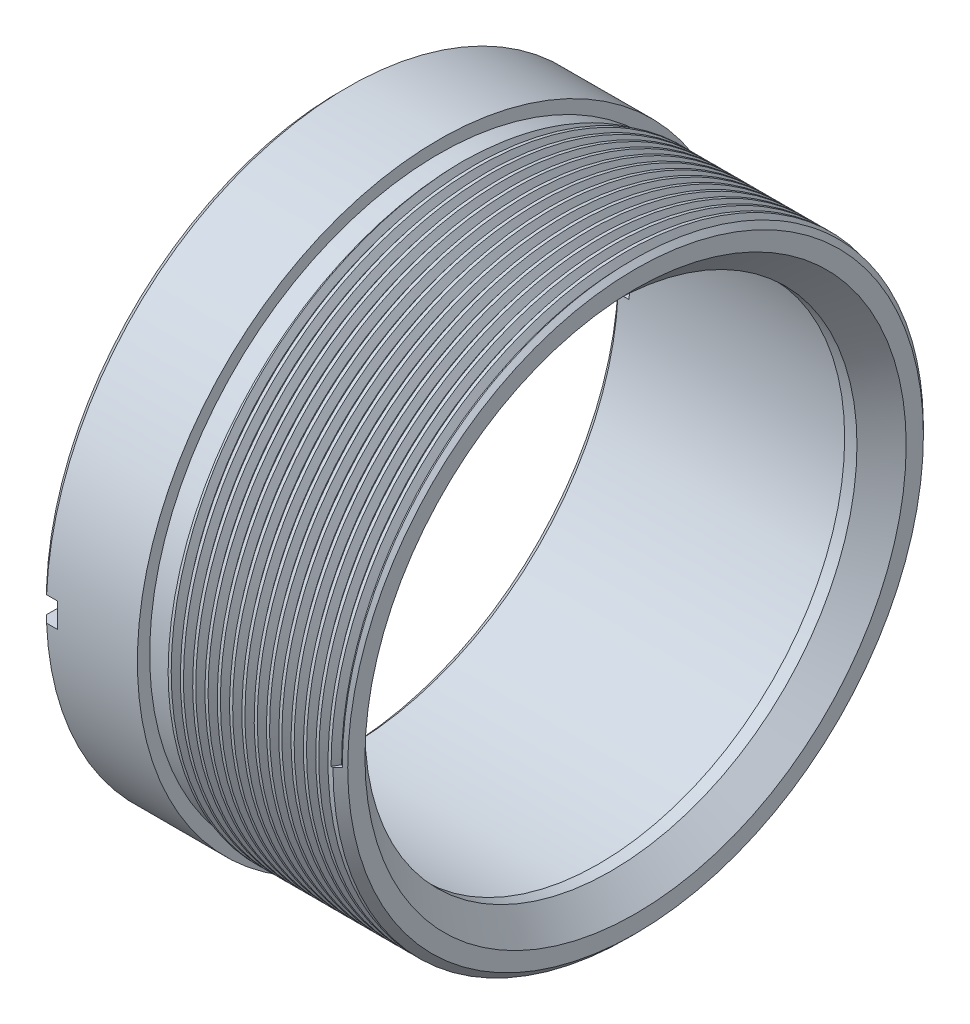
from build123d import *

# Parameters (mm, degrees)
SKETCH8_W          = 24.5
SKETCH8_H          = 1
CUT_EXTRUDE1_DEPTH = 0.75
THREAD3_PITCH      = 0.5


with BuildPart() as part:
    # Sketch1 → Revolve1 (revolve)
    with BuildSketch(Plane.XY, mode=Mode.PRIVATE) as revolve1_sk:
        Polygon((0, -11.3), (0, -11.95), (0.3, -12.25), (4, -12.25), (4, -11.75), (5, -11.75), (5, -12), (11.7, -12), (12, -11.7), (12, -11), (11, -10), (10.5, -10), (10.5, -11), (0.3, -11), align=None)
    revolve(revolve1_sk.sketch.rotate(Axis((35.470277062, 0, 0), (-1, 0, 0)), 270), axis=Axis((35.470277062, 0, 0), (-1, 0, 0)))

    # Sketch8 → Cut-Extrude1 (cut)
    with BuildSketch(Plane.ZY):
        Rectangle(SKETCH8_W, SKETCH8_H)
    extrude(amount=-CUT_EXTRUDE1_DEPTH, mode=Mode.SUBTRACT)

    # Thread3: the profile of Thread Profile3 profile screwed along a right-hand helix of 14 turns, 6 arcs to a turn; built about Z, then put on its axis
    thread3_z = Axis((0, 0, 0), (0, 0, 1))
    thread3_corners = [(12.0003, 0, 0.375173207), (11.72936706, 0, 0.218750001), (11.72936706, 0, 0.156250001), (12.0003, 0, -0.000173205)]
    with BuildLine(mode=Mode.PRIVATE) as thread3_profile:
        Line(thread3_corners[0], thread3_corners[1])
        Line(thread3_corners[1], thread3_corners[2])
        Line(thread3_corners[2], thread3_corners[3])
        Line(thread3_corners[3], thread3_corners[0])
    thread3_cap = Face(thread3_profile.wire())
    thread3_turn_angles = [0, 30, 60, 90, 120, 150, 180, 210, 240, 270, 300, 330, 360]
    thread3_turn_weights = [1, 0.8660254037844387, 1, 0.8660254037844387, 1, 0.8660254037844387, 1, 0.8660254037844387, 1, 0.8660254037844387, 1, 0.8660254037844387, 1]
    thread3_turn_rails = [Edge.make_bspline([Vector(p[0], p[1], 0).rotate(thread3_z, thread3_turn_angles[k]) / thread3_turn_weights[k] + Vector(0, 0, p[2] + THREAD3_PITCH * thread3_turn_angles[k] / 360) for k in range(13)], [0, 0, 0, 1, 1, 2, 2, 3, 3, 4, 4, 5, 5, 6, 6, 6], 2, thread3_turn_weights) for p in thread3_corners]
    thread3_turn_sides = [Face.make_surface_from_curves(thread3_turn_rails[p[0]], thread3_turn_rails[p[1]]) for p in [(0, 1), (1, 2), (2, 3), (3, 0)]]
    thread3 = Plane(origin=(12, 0, 0), x_dir=(0, 0, 1), z_dir=(-1, 0, 0)) * Solid(Shell([*[p.moved(Location((0, 0, THREAD3_PITCH * i))) for i in range(14) for p in thread3_turn_sides], thread3_cap, thread3_cap.rotate(thread3_z, 5040).moved(Location((0, 0, THREAD3_PITCH * 5040 / 360)))]))
    add(thread3, mode=Mode.SUBTRACT)


solid = part.part
